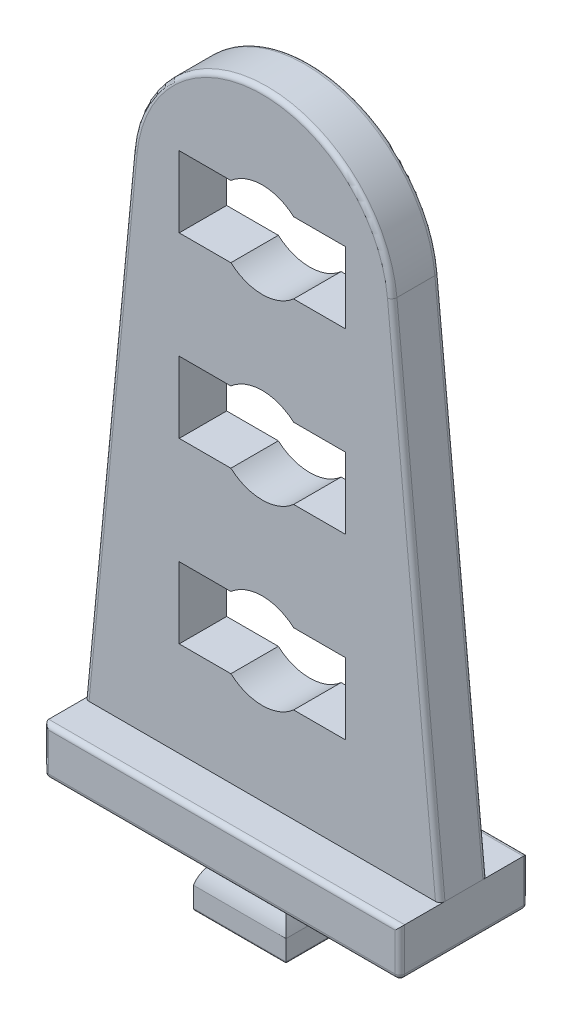
from build123d import *

# Parameters (mm, degrees)
EXTRUDE_1_DEPTH          = 2.7
EXTRUDE_1_DEPTH_BACK     = 2.7
EXTRUDE_2_DEPTH          = 1
EXTRUDE_2_DEPTH_BACK     = 1
CUT_EXTRUDE_1_DEPTH      = 30.222251796
PATTERN_LINEAR_1_COUNT   = 3
PATTERN_LINEAR_1_PITCH   = 7.5
EXTRUDE_3_DEPTH          = 2
EXTRUDE_3_DEPTH_BACK     = 2
CUT_EXTRUDE_2_DEPTH      = 2
CUT_EXTRUDE_2_DEPTH_BACK = 2
FILLET_1_R               = 0.1
FILLET_4_R               = 0.2
FILLET_5_R               = 0.2
FILLET_8_R               = 0.2


with BuildPart() as part:
    # 草图1 → 凸台-拉伸1 (new, two sides: drawn at the far end of the back side and taken through both)
    with BuildSketch(Plane.XY.offset(-EXTRUDE_1_DEPTH_BACK)):
        Polygon((0, 0), (7.5, 0), (7.5, 2), (-7.5, 2), (-7.5, 0), align=None)
    extrude(amount=EXTRUDE_1_DEPTH + EXTRUDE_1_DEPTH_BACK)

    # 草图2 → 凸台-拉伸2 (add, two sides: drawn at the far end of the back side and taken through both)
    with BuildSketch(Plane.XY.offset(-EXTRUDE_2_DEPTH_BACK)):
        with BuildLine():
            Line((-7.5, 2), (-5.474663278, 23.027315834))
            ThreePointArc((-5.474663278, 23.027315834), (0, 28), (5.474663278, 23.027315834))
            Line((5.474663278, 23.027315834), (7.5, 2))
            Line((7.5, 2), (-7.5, 2))
        make_face()
    extrude(amount=EXTRUDE_2_DEPTH + EXTRUDE_2_DEPTH_BACK)

    # 草图3 → 切除-拉伸1 (cut, through all)
    with BuildSketch(Plane.XY.offset(1)):
        with BuildLine():
            Line((3.5, 6), (3.5, 9))
            Line((3.5, 9), (1.322875656, 9))
            ThreePointArc((1.322875656, 9), (0, 9.5), (-1.322875656, 9))
            Line((-1.322875656, 9), (-3.5, 9))
            Line((-3.5, 9), (-3.5, 6))
            Line((-3.5, 6), (-1.322875656, 6))
            ThreePointArc((-1.322875656, 6), (0, 5.5), (1.322875656, 6))
            Line((1.322875656, 6), (3.5, 6))
        make_face()
    cut_extrude_1 = extrude(amount=-CUT_EXTRUDE_1_DEPTH, mode=Mode.SUBTRACT)

    # 阵列(线性)1: 切除-拉伸1 ×3
    with Locations(*[(0, i * PATTERN_LINEAR_1_PITCH, 0) for i in range(1, PATTERN_LINEAR_1_COUNT)]):
        add(cut_extrude_1, mode=Mode.SUBTRACT)

    # 草图4 → 凸台-拉伸3 (add, two sides: drawn at the far end of the back side and taken through both)
    with BuildSketch(Plane.XY.offset(-EXTRUDE_3_DEPTH_BACK)):
        with BuildLine():
            Line((1.5, 0), (-1.5, 0))
            Line((-1.5, 0), (-1.5, -0.677124344))
            ThreePointArc((-1.5, -0.677124344), (-1.780042303, -1.088161527), (-1.95, -1.555590279))
            Line((-1.95, -1.555590279), (-1.95, -2.5))
            Line((-1.95, -2.5), (1.95, -2.5))
            Line((1.95, -2.5), (1.95, -1.555590279))
            ThreePointArc((1.95, -1.555590279), (1.780042303, -1.088161527), (1.5, -0.677124344))
            Line((1.5, -0.677124344), (1.5, 0))
        make_face()
    extrude(amount=EXTRUDE_3_DEPTH + EXTRUDE_3_DEPTH_BACK)

    # 草图5 → 切除-拉伸2 (cut, two sides: drawn at the far end of the back side and taken through both)
    with BuildSketch(Plane(origin=(0, 0, 0), x_dir=(0, 0, -1), z_dir=(1, 0, 0)).offset(-CUT_EXTRUDE_2_DEPTH_BACK)):
        with BuildLine():
            Line((1.5, 0), (1.5, -0.677124344))
            ThreePointArc((1.5, -0.677124344), (1.780042303, -1.088161527), (1.95, -1.555590279))
            Line((1.95, -1.555590279), (1.95, -2.5))
            Line((1.95, -2.5), (2, -2.5))
            Line((2, -2.5), (2, 0))
            Line((2, 0), (1.5, 0))
        make_face()
        with BuildLine():
            Line((-2, 0), (-1.5, 0))
            Line((-1.5, 0), (-1.5, -0.677124344))
            ThreePointArc((-1.5, -0.677124344), (-1.780042303, -1.088161527), (-1.95, -1.555590279))
            Line((-1.95, -1.555590279), (-1.95, -2.5))
            Line((-1.95, -2.5), (-2, -2.5))
            Line((-2, -2.5), (-2, 0))
        make_face()
    extrude(amount=CUT_EXTRUDE_2_DEPTH + CUT_EXTRUDE_2_DEPTH_BACK, mode=Mode.SUBTRACT)

    # 圆角1
    fillet_1_edges = [part.edges().sort_by_distance(p)[0] for p in [
        (-1.95, -2.5, 0),
        (1.95, -2.5, 0),
        (0, -2.5, -1.95),
        (0, -2.5, 1.95),
    ]]
    fillet(fillet_1_edges, radius=FILLET_1_R)

    # 圆角4
    fillet_4_edges = [part.edges().sort_by_distance(p)[0] for p in [
        (-7.5, 1, 2.7),
        (0, 2, 2.7),
        (7.5, 1, 2.7),
        (0, 0, 2.7),
        (7.5, 1, -2.7),
        (0, 2, -2.7),
        (-7.5, 1, -2.7),
        (0, 0, -2.7),
    ]]
    fillet(fillet_4_edges, radius=FILLET_4_R)

    # 圆角5
    # the kernel refuses this fillet: 0.2 mm, written as the material it takes off along each edge
    with BuildSketch(Plane(origin=(7.3, 0.2, 2.5), x_dir=(1, 0, 0), z_dir=(0, -1, 0))) as fillet_5_piece_1_section:
        Polygon((0, 0), (FILLET_5_R, 0), (FILLET_5_R, FILLET_5_R), (0, FILLET_5_R), align=None)
    fillet_5_piece_1 = extrude(amount=FILLET_5_R, mode=Mode.PRIVATE)
    fillet_5_piece_1 = fillet_5_piece_1 - Plane(origin=(7.3, 0.2, 2.5), x_dir=(-0.7071067811865475, 0, -0.7071067811865475), z_dir=(0, -1, 0)) * Sphere(FILLET_5_R, mode=Mode.PRIVATE)
    add(fillet_5_piece_1, mode=Mode.SUBTRACT)
    with BuildSketch(Plane(origin=(-7.3, 0.2, 2.5), x_dir=(-1, 0, 0), z_dir=(0, -1, 0))) as fillet_5_piece_2_section:
        Polygon((0, 0), (FILLET_5_R, 0), (FILLET_5_R, -FILLET_5_R), (0, -FILLET_5_R), align=None)
    fillet_5_piece_2 = extrude(amount=FILLET_5_R, mode=Mode.PRIVATE)
    fillet_5_piece_2 = fillet_5_piece_2 - Plane(origin=(-7.3, 0.2, 2.5), x_dir=(0.7071067811865475, 1.2560739669470211e-15, -0.7071067811865475), z_dir=(0, -1, 0)) * Sphere(FILLET_5_R, mode=Mode.PRIVATE)
    add(fillet_5_piece_2, mode=Mode.SUBTRACT)
    with BuildSketch(Plane(origin=(-7.3, 0.2, -2.5), x_dir=(-1, 0, 0), z_dir=(0, -1, 0))) as fillet_5_piece_3_section:
        Polygon((0, 0), (FILLET_5_R, 0), (FILLET_5_R, FILLET_5_R), (0, FILLET_5_R), align=None)
    fillet_5_piece_3 = extrude(amount=FILLET_5_R, mode=Mode.PRIVATE)
    fillet_5_piece_3 = fillet_5_piece_3 - Plane(origin=(-7.3, 0.2, -2.5), x_dir=(0.7071067811865475, 1.2560739669470211e-15, 0.7071067811865475), z_dir=(0, -1, 0)) * Sphere(FILLET_5_R, mode=Mode.PRIVATE)
    add(fillet_5_piece_3, mode=Mode.SUBTRACT)
    with BuildSketch(Plane(origin=(7.3, 0.2, -2.5), x_dir=(1, 0, 0), z_dir=(0, -1, 0))) as fillet_5_piece_4_section:
        Polygon((0, 0), (FILLET_5_R, 0), (FILLET_5_R, -FILLET_5_R), (0, -FILLET_5_R), align=None)
    fillet_5_piece_4 = extrude(amount=FILLET_5_R, mode=Mode.PRIVATE)
    fillet_5_piece_4 = fillet_5_piece_4 - Plane(origin=(7.3, 0.2, -2.5), x_dir=(-0.7071067811865475, 0, 0.7071067811865475), z_dir=(0, -1, 0)) * Sphere(FILLET_5_R, mode=Mode.PRIVATE)
    add(fillet_5_piece_4, mode=Mode.SUBTRACT)
    with BuildSketch(Plane(origin=(-7.5, 0, 2.5), x_dir=(1, 0, 0), z_dir=(0, 0, -1)), Plane(origin=(7.5, 0, -2.5), x_dir=(-1, 0, 0), z_dir=(0, 0, 1))) as fillet_5_piece_5:
        with BuildLine():
            CenterArc((FILLET_5_R, -FILLET_5_R), FILLET_5_R, 90, 90)
            Line((0, -FILLET_5_R), (0, 0))
            Line((0, 0), (FILLET_5_R, 0))
        make_face()
    extrude(amount=5, mode=Mode.SUBTRACT)

    # 圆角8
    # the kernel refuses this fillet: 0.2 mm, written as the material it takes off along each edge
    with BuildSketch(Plane(origin=(-7.547937803, 1.502303338, 1), x_dir=(0, 0, -1), z_dir=(0.09587560610090687, 0.9953933233424785, 0))) as fillet_8_piece_1_section:
        with BuildLine():
            CenterArc((FILLET_8_R, -FILLET_8_R), FILLET_8_R, 90, 90)
            Line((0, -FILLET_8_R), (0, 0))
            Line((0, 0), (FILLET_8_R, 0))
        make_face()
    fillet_8_piece_1 = extrude(amount=21.624630174, mode=Mode.PRIVATE)
    fillet_8_piece_1 = split(fillet_8_piece_1, bisect_by=Plane(origin=(-6.442060612, 2, 0.954715968), z_dir=(0, 1, 0)), keep=Keep.TOP, mode=Mode.PRIVATE)
    add(fillet_8_piece_1, mode=Mode.SUBTRACT)
    with BuildSketch(Plane(origin=(5.474663278, 23.027315834, -1), x_dir=(0, 0, 1), z_dir=(0.09587560610090687, -0.9953933233424785, 0))) as fillet_8_piece_2_section:
        with BuildLine():
            CenterArc((FILLET_8_R, FILLET_8_R), FILLET_8_R, 180, 90)
            Line((0, FILLET_8_R), (0, 0))
            Line((0, 0), (FILLET_8_R, 0))
        make_face()
    fillet_8_piece_2 = extrude(amount=21.624630174, mode=Mode.PRIVATE)
    fillet_8_piece_2 = split(fillet_8_piece_2, bisect_by=Plane(origin=(6.442060612, 2, -0.954715968), z_dir=(0, 1, 0)), keep=Keep.TOP, mode=Mode.PRIVATE)
    add(fillet_8_piece_2, mode=Mode.SUBTRACT)
    with BuildSketch(Plane(origin=(0, 22.5, -1), x_dir=(-0.9953933233424784, 0.09587560610090734, 0), z_dir=(-0.09587560610090734, -0.9953933233424784, 0))) as fillet_8_piece_3:
        with BuildLine():
            CenterArc((5.5 - FILLET_8_R, -FILLET_8_R), FILLET_8_R, 0, 90)
            Line((5.5, -FILLET_8_R), (5.5, 0))
            Line((5.5, 0), (5.5 - FILLET_8_R, 0))
        make_face()
    revolve(axis=Axis((0, 22.5, -1), (0, 0, -1)), revolution_arc=168.996563204, mode=Mode.SUBTRACT)
    with BuildSketch(Plane(origin=(-7.547937803, 1.502303338, -1), x_dir=(0, 0, 1), z_dir=(0.09587560610090687, 0.9953933233424785, 0))) as fillet_8_piece_4_section:
        with BuildLine():
            CenterArc((FILLET_8_R, FILLET_8_R), FILLET_8_R, 180, 90)
            Line((0, FILLET_8_R), (0, 0))
            Line((0, 0), (FILLET_8_R, 0))
        make_face()
    fillet_8_piece_4 = extrude(amount=21.624630174, mode=Mode.PRIVATE)
    fillet_8_piece_4 = split(fillet_8_piece_4, bisect_by=Plane(origin=(-6.442060612, 2, -0.954715968), z_dir=(0, 1, 0)), keep=Keep.TOP, mode=Mode.PRIVATE)
    add(fillet_8_piece_4, mode=Mode.SUBTRACT)
    with BuildSketch(Plane(origin=(0, 22.5, 1), x_dir=(-0.9953933233424784, 0.09587560610090734, 0), z_dir=(-0.09587560610090734, -0.9953933233424784, 0))) as fillet_8_piece_5:
        with BuildLine():
            CenterArc((5.5 - FILLET_8_R, FILLET_8_R), FILLET_8_R, 270, 90)
            Line((5.5 - FILLET_8_R, 0), (5.5, 0))
            Line((5.5, 0), (5.5, FILLET_8_R))
        make_face()
    revolve(axis=Axis((0, 22.5, 1), (0, 0, -1)), revolution_arc=168.996563204, mode=Mode.SUBTRACT)
    with BuildSketch(Plane(origin=(5.474663278, 23.027315834, 1), x_dir=(0, 0, -1), z_dir=(0.09587560610090687, -0.9953933233424785, 0))) as fillet_8_piece_6_section:
        with BuildLine():
            CenterArc((FILLET_8_R, -FILLET_8_R), FILLET_8_R, 90, 90)
            Line((0, -FILLET_8_R), (0, 0))
            Line((0, 0), (FILLET_8_R, 0))
        make_face()
    fillet_8_piece_6 = extrude(amount=21.624630174, mode=Mode.PRIVATE)
    fillet_8_piece_6 = split(fillet_8_piece_6, bisect_by=Plane(origin=(6.442060612, 2, 0.954715968), z_dir=(0, 1, 0)), keep=Keep.TOP, mode=Mode.PRIVATE)
    add(fillet_8_piece_6, mode=Mode.SUBTRACT)


solid = part.part
